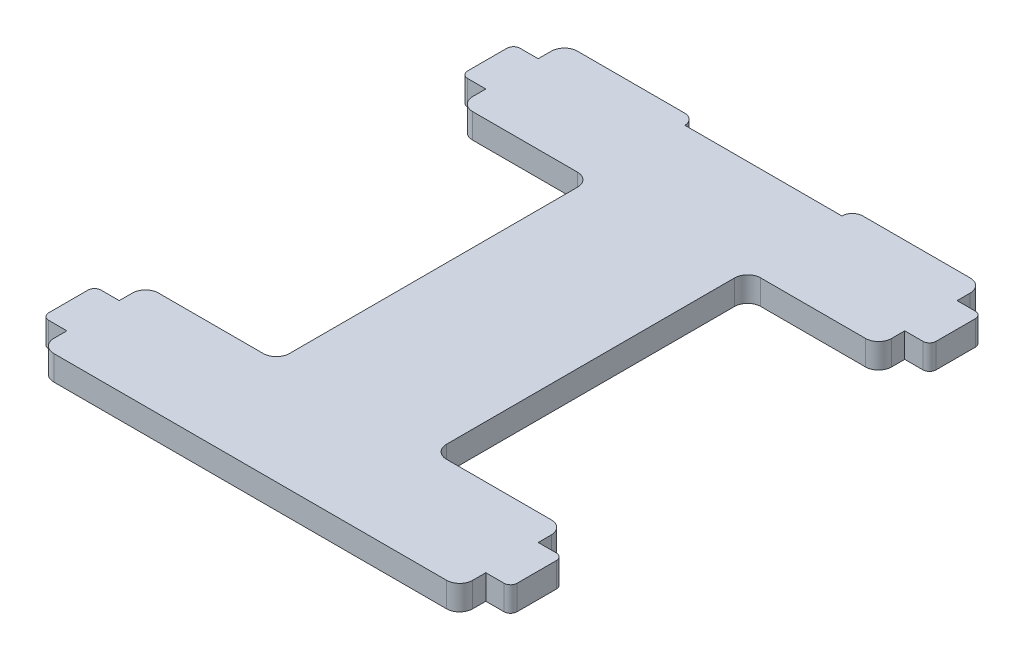
from build123d import *

# Parameters (mm, degrees)
BOSS_EXTRUDE1_DEPTH = 1.5
FILLET1_R           = 1.5875
SKETCH2_W           = 3
SKETCH2_H           = 6.35
BOSS_EXTRUDE2_DEPTH = 3
FILLET2_R           = 0.79375
FILLET3_R           = 1.27


with BuildPart() as part:
    # Sketch1 → Boss-Extrude1 (new, symmetric)
    with BuildSketch(Plane(origin=(0, 0, 0), x_dir=(1, 0, 0), z_dir=(0, 1, 0))):
        Polygon((25.4, 19.05), (9.525, 19.05), (9.525, -19.05), (25.4, -19.05), (25.4, -31.75), (-25.4, -31.75), (-25.4, -19.05), (-9.525, -19.05), (-9.525, 19.05), (-25.4, 19.05), (-25.4, 31.75), (-9.525, 31.75), (-9.525, 30.48), (9.525, 30.48), (9.525, 31.75), (25.4, 31.75), align=None)
    extrude(amount=BOSS_EXTRUDE1_DEPTH, both=True)

    # Fillet1
    fillet1_edges = [part.edges().sort_by_distance(p)[0] for p in [
        (25.4, 0, -31.75),
        (25.4, 0, -19.05),
        (9.525, 0, -19.05),
        (9.525, 0, 19.05),
        (25.4, 0, 19.05),
        (25.4, 0, 31.75),
        (-25.4, 0, 31.75),
        (-25.4, 0, 19.05),
        (-9.525, 0, 19.05),
        (-9.525, 0, -19.05),
        (-25.4, 0, -19.05),
        (-25.4, 0, -31.75),
    ]]
    fillet(fillet1_edges, radius=FILLET1_R)

    # Sketch2 → Boss-Extrude2 (add)
    with BuildSketch(Plane(origin=(0, 1.5, 0), x_dir=(1, 0, 0), z_dir=(0, 1, 0))):
        with Locations((-26.9, 25.4)):
            Rectangle(SKETCH2_W, SKETCH2_H)
        with Locations((26.9, 25.4)):
            Rectangle(SKETCH2_W, SKETCH2_H)
        with Locations((26.9, -25.4)):
            Rectangle(SKETCH2_W, SKETCH2_H)
        with Locations((-26.9, -25.4)):
            Rectangle(SKETCH2_W, SKETCH2_H)
    extrude(amount=-BOSS_EXTRUDE2_DEPTH)

    # Fillet2
    fillet2_edges = [part.edges().sort_by_distance(p)[0] for p in [
        (-28.4, 0, 28.575),
        (-28.4, 0, 22.225),
        (28.4, 0, 22.225),
        (28.4, 0, 28.575),
        (28.4, 0, -28.575),
        (28.4, 0, -22.225),
        (-28.4, 0, -22.225),
        (-28.4, 0, -28.575),
    ]]
    fillet(fillet2_edges, radius=FILLET2_R)

    # Fillet3
    fillet3_edges = [part.edges().sort_by_distance(p)[0] for p in [
        (9.525, 0, -31.75),
        (-9.525, 0, -31.75),
    ]]
    fillet(fillet3_edges, radius=FILLET3_R - 0.0001)  # a hair under: the kernel refuses the full size


solid = part.part
